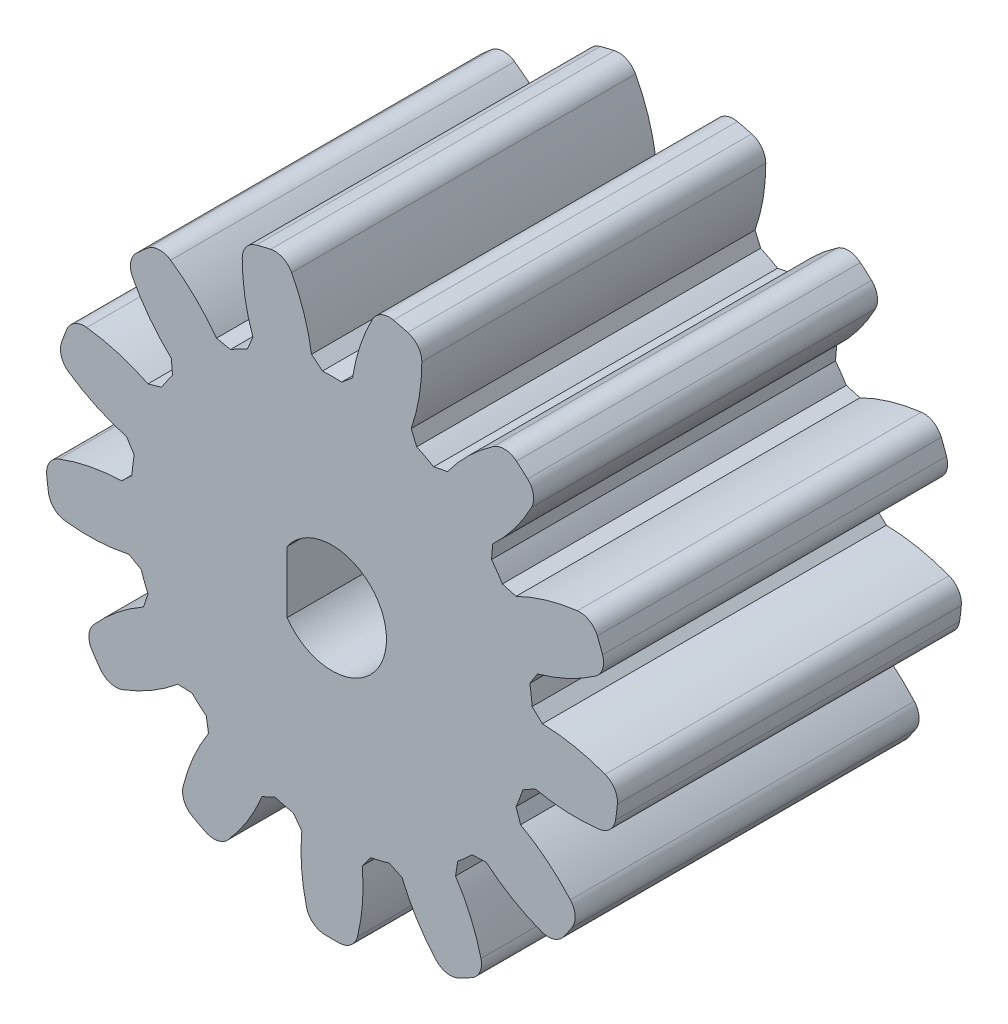
from build123d import *

# Parameters (mm, degrees)
SKETCH1_R           = 15
BOSS_EXTRUDE1_DEPTH = 9
CUT_EXTRUDE1_DEPTH  = 24.043437244
CIRPATTERN1_COUNT   = 13
FILLET1_R           = 1
SKETCH3_R           = 2.85
CUT_EXTRUDE2_DEPTH  = 24
BOSS_EXTRUDE2_DEPTH = 8.5
FILLET3_R           = 1
CHAMFER2_SIZE       = 1


with BuildPart() as part:
    # Sketch1 → Boss-Extrude1 (new, symmetric)
    with BuildSketch(Plane.XY):
        Circle(SKETCH1_R)
    extrude(amount=BOSS_EXTRUDE1_DEPTH, both=True)

    # Sketch2 → Cut-Extrude1 (cut, symmetric)
    with BuildSketch(Plane.XY):
        with BuildLine():
            Line((2.488704723, 14.792104272), (2.488704723, 15.173999235))
            Line((2.488704723, 15.173999235), (-2.614354336, 15.173999235))
            Line((-2.614354336, 15.173999235), (-2.488704723, 14.792104272))
            ThreePointArc((-2.488704723, 14.792104272), (-1.497391845, 12.707607266), (-1.01110734, 10.451203852))
            ThreePointArc((-1.01110734, 10.451203852), (0, 10.5), (1.01110734, 10.451203852))
            ThreePointArc((1.01110734, 10.451203852), (1.497391845, 12.707607266), (2.488704723, 14.792104272))
        make_face()
    cut_extrude1 = extrude(amount=CUT_EXTRUDE1_DEPTH, both=True, mode=Mode.SUBTRACT)

    # CirPattern1: Cut-Extrude1 ×13 about axis
    cirpattern1_axis = Axis((0, 0, 0), (0, 0, 1))
    for i in range(1, CIRPATTERN1_COUNT):
        add(cut_extrude1.rotate(cirpattern1_axis, i * 360 / CIRPATTERN1_COUNT), mode=Mode.SUBTRACT)

    # Fillet1
    fillet1_edges = [part.edges().sort_by_distance(p)[0] for p in [
        (11.67180174, -9.421732544, 0),
        (7.946157272, -12.722365527, 0),
        (14.713364615, -2.918373125, 0),
        (-2.488704723, 14.792104272, 0),
        (12.948350901, -7.572331804, 0),
        (5.956369747, -13.766686582, 0),
        (1.123594773, -14.95785863, 0),
        (2.488704723, 14.792104272, 0),
        (-1.123594773, -14.95785863, 0),
        (-5.956369747, -13.766686582, 0),
        (-12.948350901, -7.572331804, 0),
        (-14.713364615, -2.918373125, 0),
        (-7.946157272, -12.722365527, 0),
        (-11.67180174, -9.421732544, 0),
        (-9.077872212, 11.941199107, 0),
        (-4.670595026, 14.254316613, 0),
        (-13.587408577, 6.354709133, 0),
        (-10.759917741, 10.451036801, 0),
        (-14.984233383, -0.68756812, 0),
        (-14.384272972, 4.253550406, 0),
        (4.670595026, 14.254316613, 0),
        (9.077872212, 11.941199107, 0),
        (10.759917741, 10.451036801, 0),
        (13.587408577, 6.354709133, 0),
        (14.384272972, 4.253550406, 0),
        (14.984233383, -0.68756812, 0),
    ]]
    fillet(fillet1_edges, radius=FILLET1_R)

    # Chamfer1
    # the kernel refuses this chamfer: 0.5 mm, written as the material it adds along each edge
    with BuildSketch(Plane(origin=(7.687254792, -7.152350227, 9), x_dir=(-0.6988462718759633, -0.7152718981513725, 0), z_dir=(0, 0, -1)), Plane(origin=(3.482863191, -9.905537037, 9), x_dir=(-0.9512010678205252, -0.3085717559613855, 0), z_dir=(0, 0, -1)), Plane(origin=(-1.519410394, -10.389484687, 9), x_dir=(-0.9856471623429421, 0.16881845682657493, 0), z_dir=(0, 0, -1)), Plane(origin=(-9.413501753, -4.651449748, 9), x_dir=(-0.42097653940929197, 0.9070715259928386, 0), z_dir=(0, 0, -1)), Plane(origin=(-6.173605368, -8.493326601, 9), x_dir=(-0.7942933703085662, 0.6075343956385179, 0), z_dir=(0, 0, -1)), Plane(origin=(-10.496878331, 0.256018188, 9), x_dir=(0.048780943351376956, 0.998809501139106, 0), z_dir=(0, 0, -1))) as chamfer1_piece_1:
        with BuildLine():
            Line((0.512668458, 0), (-0.025719054, -0.512719416))
            ThreePointArc((-0.025719054, -0.512719416), (-0.009930751, -0.26377362), (0, 0))
            ThreePointArc((0, 0), (0.263582733, -0.00312688), (0.512668458, 0))
        make_face()
    extrude(amount=18)
    with BuildSketch(Plane(origin=(6.173605368, -8.493326601, 9), x_dir=(0.5669781411868423, -0.8237328374031918, 0), z_dir=(0, 0, -1)), Plane(origin=(9.413501753, -4.651449748, 9), x_dir=(0.8848419486421701, -0.4658913241552447, 0), z_dir=(0, 0, -1)), Plane(origin=(1.519410394, -10.389484687, 9), x_dir=(0.11922647441292282, -0.9928670846589006, 0), z_dir=(0, 0, -1)), Plane(origin=(-3.482863191, -9.905537037, 9), x_dir=(-0.3558385408142222, -0.934547448164728, 0), z_dir=(0, 0, -1)), Plane(origin=(-10.130588961, -2.760646175, 9), x_dir=(-0.971256802316475, -0.23803408149669583, 0), z_dir=(0, 0, -1)), Plane(origin=(-7.687254792, -7.152350227, 9), x_dir=(-0.7493852346601237, -0.6621342538136743, 0), z_dir=(0, 0, -1)), Plane(origin=(-10.253127286, 2.263488646, 9), x_dir=(-0.9706251414754602, 0.24059683026952544, 0), z_dir=(0, 0, -1))) as chamfer1_piece_2:
        with BuildLine():
            Line((0.513364071, 0), (-0.025684204, -0.512024677))
            ThreePointArc((-0.025684204, -0.512024677), (-0.010082291, -0.263408394), (0, 0))
            ThreePointArc((0, 0), (0.263939908, -0.003296528), (0.513364071, 0))
        make_face()
    extrude(amount=18)
    with BuildSketch(Plane(origin=(-1.01110734, 10.451203852, 9), x_dir=(-0.12184667616261032, 0.9925489345660113, 0), z_dir=(0, 0, -1)), Plane(origin=(10.130588961, -2.760646175, 9), x_dir=(0.9712568023164747, -0.2380340814966975, 0), z_dir=(0, 0, -1)), Plane(origin=(-5.752207693, 8.784196415, 9), x_dir=(-0.569150362894187, 0.822233461017864, 0), z_dir=(0, 0, -1)), Plane(origin=(-9.175546584, 5.104835441, 9), x_dir=(-0.8860685604921126, 0.46355421053792145, 0), z_dir=(0, 0, -1)), Plane(origin=(3.961625519, 9.723966436, 9), x_dir=(0.35337061566617867, 0.9354834087164272, 0), z_dir=(0, 0, -1)), Plane(origin=(8.026797714, 6.769085497, 9), x_dir=(0.7476349580234212, 0.664109907727115, 0), z_dir=(0, 0, -1)), Plane(origin=(10.253127286, 2.263488646, 9), x_dir=(0.9706251414754612, 0.24059683026952128, 0), z_dir=(0, 0, -1))) as chamfer1_piece_3:
        with BuildLine():
            Line((0.513364071, 0), (-0.025684204, 0.512024677))
            ThreePointArc((-0.025684204, 0.512024677), (-0.010082291, 0.263408394), (0, 0))
            ThreePointArc((0, 0), (0.263939908, 0.003296528), (0.513364071, 0))
        make_face()
    extrude(amount=18)
    with BuildSketch(Plane(origin=(1.01110734, 10.451203852, 9), x_dir=(-0.9974069482855394, 0.07196790612298887, 0), z_dir=(0, 0, -1)), Plane(origin=(-3.961625519, 9.723966436, 9), x_dir=(-0.916605146006636, -0.39979370469550085, 0), z_dir=(0, 0, -1)), Plane(origin=(-8.026797714, 6.769085497, 9), x_dir=(-0.6258201510670891, -0.7799673958047002, 0), z_dir=(0, 0, -1)), Plane(origin=(5.752207693, 8.784196415, 9), x_dir=(-0.8497148387689841, 0.5272425369560002, 0), z_dir=(0, 0, -1)), Plane(origin=(9.175546584, 5.104835441, 9), x_dir=(-0.5073632998643495, 0.8617322565337555, 0), z_dir=(0, 0, -1)), Plane(origin=(10.496878331, 0.256018188, 9), x_dir=(-0.04878094335137992, 0.9988095011391058, 0), z_dir=(0, 0, -1))) as chamfer1_piece_4:
        with BuildLine():
            Line((0.512668458, 0), (-0.025719054, 0.512719416))
            ThreePointArc((-0.025719054, 0.512719416), (-0.009930751, 0.26377362), (0, 0))
            ThreePointArc((0, 0), (0.263582733, 0.00312688), (0.512668458, 0))
        make_face()
    extrude(amount=18)

    # Sketch3 → Cut-Extrude2 (cut)
    with BuildSketch(Plane(origin=(0, 0, -9), x_dir=(-1, 0, 0), z_dir=(0, 0, -1))):
        Circle(SKETCH3_R)
    extrude(amount=-CUT_EXTRUDE2_DEPTH, mode=Mode.SUBTRACT)

    # Sketch5 → Boss-Extrude2 (add)
    with BuildSketch(Plane.XY.offset(9)):
        Polygon((-2.35, 0), (-2.35, 1.61245155), (-2.85, 1.61245155), (-2.85, -1.61245155), (-2.35, -1.61245155), align=None)
    extrude(amount=-BOSS_EXTRUDE2_DEPTH)

    # Fillet3
    # the kernel refuses this fillet: 1 mm, written as the material it takes off along each edge
    with BuildSketch(Plane(origin=(-2.35, -4.11245155, 0.5), x_dir=(-1, 0, 0), z_dir=(0, 1, 0))) as fillet3_piece_1_section:
        with BuildLine():
            CenterArc((FILLET3_R, FILLET3_R), FILLET3_R, 180, 90)
            Line((0, FILLET3_R), (0, 0))
            Line((0, 0), (FILLET3_R, 0))
        make_face()
    fillet3_piece_1 = extrude(amount=8.224903099, mode=Mode.PRIVATE)
    fillet3_piece_1 = fillet3_piece_1 & Plane(origin=(0, 0, 0.5), x_dir=(-1, 0, 0), z_dir=(0, 0, -1)) * Cylinder(2.85, 21, mode=Mode.PRIVATE)
    add(fillet3_piece_1, mode=Mode.SUBTRACT)

    # Chamfer2
    chamfer2_edges = [part.edges().sort_by_distance(p)[0] for p in [
        (2.85, 0, -9),
    ]]
    chamfer(chamfer2_edges, length=CHAMFER2_SIZE)


solid = part.part
